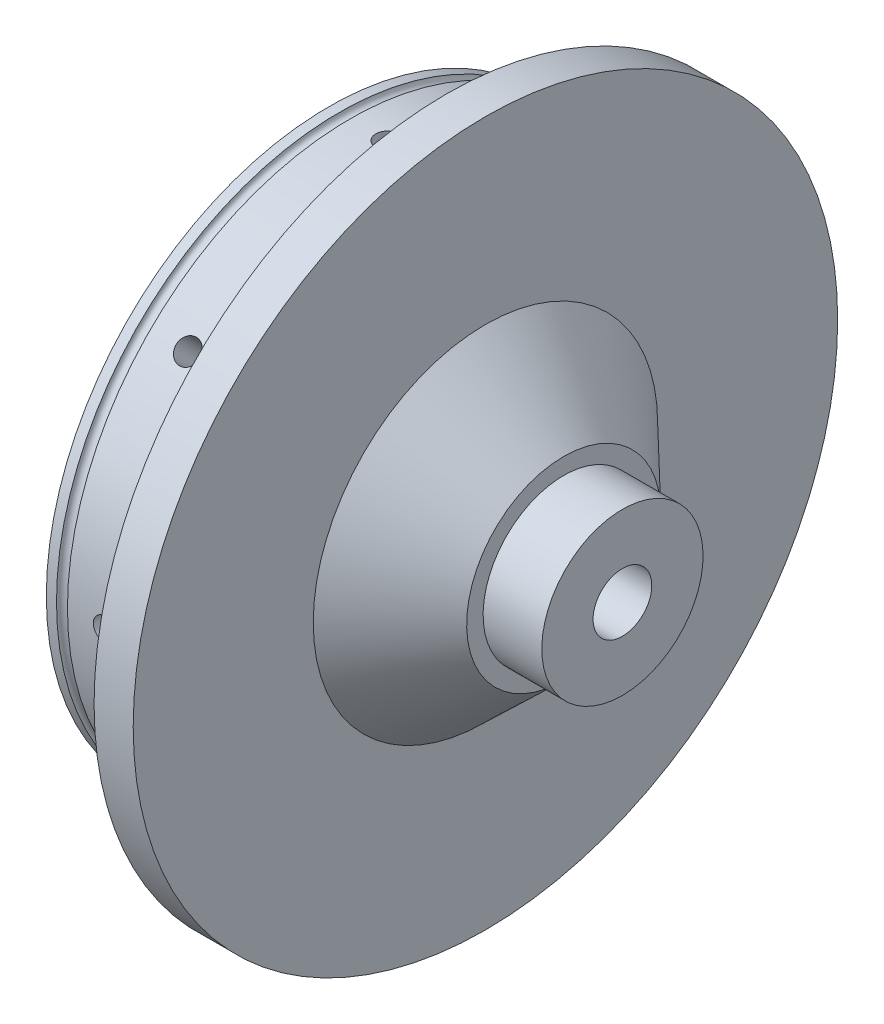
from build123d import *

# Parameters (mm, degrees)
SKETCH1_R           = 57.15
BOSS_EXTRUDE1_DEPTH = 6.35
SKETCH2_R           = 45.847
BOSS_EXTRUDE2_DEPTH = 19.05
SKETCH3_R           = 38.227
CUT_EXTRUDE1_DEPTH  = 6.35
SKETCH5_R           = 0.889
SKETCH6_R           = 1.905
CUT_EXTRUDE3_DEPTH  = 6.35
CIRPATTERN1_COUNT   = 8
SKETCH10_R          = 1.1303
CUT_EXTRUDE5_DEPTH  = 5.08
SKETCH18_R          = 13.081
BOSS_EXTRUDE6_DEPTH = 9.525
SKETCH19_R          = 4.7625
CUT_EXTRUDE7_DEPTH  = 94.810370562


with BuildPart() as part:
    # Sketch1 → Boss-Extrude1 (new body)
    with BuildSketch(Plane(origin=(0, 0, 0), x_dir=(0, 0, -1), z_dir=(1, 0, 0))):
        Circle(SKETCH1_R)
    extrude(amount=BOSS_EXTRUDE1_DEPTH)

    # Sketch2 → Boss-Extrude2 (add)
    with BuildSketch(Plane.ZY):
        Circle(SKETCH2_R)
    extrude(amount=BOSS_EXTRUDE2_DEPTH)

    # Sketch3 → Cut-Extrude1 (cut)
    with BuildSketch(Plane.ZY.offset(19.05)):
        Circle(SKETCH3_R)
    extrude(amount=-CUT_EXTRUDE1_DEPTH, mode=Mode.SUBTRACT)

    # Sketch5 → Cut-Revolve1 (revolve, cut)
    with BuildSketch(Plane.XY):
        with Locations((-16.51, 45.847)):
            Circle(SKETCH5_R)
    revolve(axis=Axis((0, 0, 0), (-1, 0, 0)), mode=Mode.SUBTRACT)

    # Sketch6 → Cut-Extrude3 (cut)
    with BuildSketch(Plane.XY.offset(45.847)):
        with Locations((-9.525, 0)):
            Circle(SKETCH6_R)
    cut_extrude3 = extrude(amount=-CUT_EXTRUDE3_DEPTH, mode=Mode.SUBTRACT)

    # CirPattern1: Cut-Extrude3 ×8 about axis
    cirpattern1_axis = Axis((-19.05, 0, 0), (1, 0, 0))
    for i in range(1, CIRPATTERN1_COUNT):
        add(cut_extrude3.rotate(cirpattern1_axis, i * 360 / CIRPATTERN1_COUNT), mode=Mode.SUBTRACT)

    # Sketch10 → Cut-Extrude5 (cut)
    with BuildSketch(Plane.ZY.offset(12.7)):
        with Locations((0, 33.3375)):
            Circle(SKETCH10_R)
        with Locations((23.573172318, 23.573172318)):
            Circle(SKETCH10_R)
        with Locations((33.3375, 0)):
            Circle(SKETCH10_R)
        with Locations((23.573172318, -23.573172318)):
            Circle(SKETCH10_R)
        with Locations((0, -33.3375)):
            Circle(SKETCH10_R)
        with Locations((-23.573172318, -23.573172318)):
            Circle(SKETCH10_R)
        with Locations((-33.3375, 0)):
            Circle(SKETCH10_R)
        with Locations((-23.573172318, 23.573172318)):
            Circle(SKETCH10_R)
    extrude(amount=-CUT_EXTRUDE5_DEPTH, mode=Mode.SUBTRACT)

    # Sketch17 → Revolve1 (revolve)
    with BuildSketch(Plane.XY):
        Polygon((19.05, 0), (6.35, 0), (6.35, 27.94), (19.05, 15.748), align=None)
    revolve(axis=Axis((19.05, 0, 0), (-1, 0, 0)))

    # Sketch18 → Boss-Extrude6 (add)
    with BuildSketch(Plane(origin=(19.05, 0, 0), x_dir=(0, 0, -1), z_dir=(1, 0, 0))):
        Circle(SKETCH18_R)
    extrude(amount=BOSS_EXTRUDE6_DEPTH)

    # Sketch19 → Cut-Extrude7 (cut, through all)
    with BuildSketch(Plane(origin=(28.575, 0, 0), x_dir=(0, 0, -1), z_dir=(1, 0, 0))):
        Circle(SKETCH19_R)
    extrude(amount=-CUT_EXTRUDE7_DEPTH, mode=Mode.SUBTRACT)

    # Sketch20 → Cut-Revolve2 (revolve, cut)
    with BuildSketch(Plane.XY):
        Polygon((19.05, 4.7625), (-12.7, 4.7625), (-12.7, 30.1625), align=None)
    revolve(axis=Axis((0, 0, 0), (-1, 0, 0)), mode=Mode.SUBTRACT)


solid = part.part
